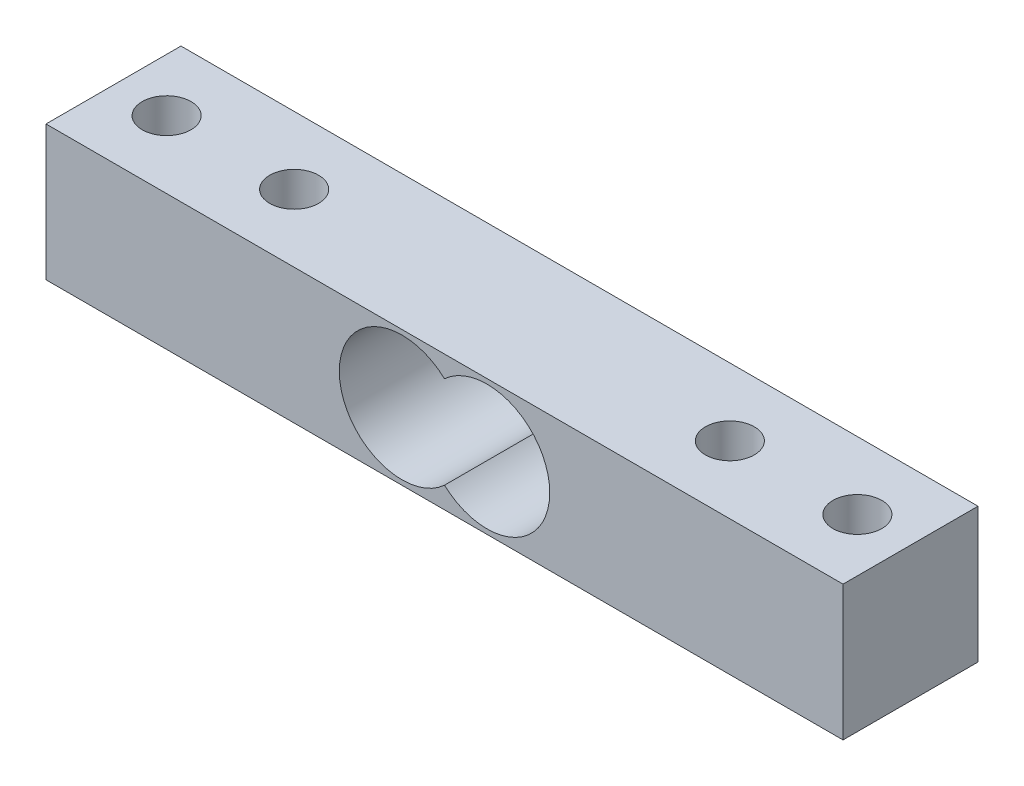
from build123d import *

# Parameters (mm, degrees)
CROQUIS2_W              = 75
CROQUIS2_H              = 12.7
SALIENTE_EXTRUIR1_DEPTH = 6.35
CROQUIS3_R              = 2.3
CORTAR_EXTRUIR1_DEPTH   = 41.098160806


with BuildPart() as part:
    # Croquis2 → Saliente-Extruir1 (new, symmetric)
    with BuildSketch(Plane.XY):
        Rectangle(CROQUIS2_W, CROQUIS2_H)
        with BuildLine():
            ThreePointArc((0, 4.337049688), (-9.9, 0), (0, -4.337049688))
            ThreePointArc((0, -4.337049688), (9.9, 0), (0, 4.337049688))
        make_face(mode=Mode.SUBTRACT)
    extrude(amount=SALIENTE_EXTRUIR1_DEPTH, both=True)

    # Croquis3 → Cortar-Extruir1 (cut, through all)
    with BuildSketch(Plane(origin=(0, 6.35, 0), x_dir=(1, 0, 0), z_dir=(0, 1, 0))):
        with Locations((32.5, 0)):
            Circle(CROQUIS3_R)
        with Locations((20.5, 0)):
            Circle(CROQUIS3_R)
        with Locations((-32.5, 0)):
            Circle(CROQUIS3_R)
        with Locations((-20.5, 0)):
            Circle(CROQUIS3_R)
    extrude(amount=-CORTAR_EXTRUIR1_DEPTH, mode=Mode.SUBTRACT)


solid = part.part
